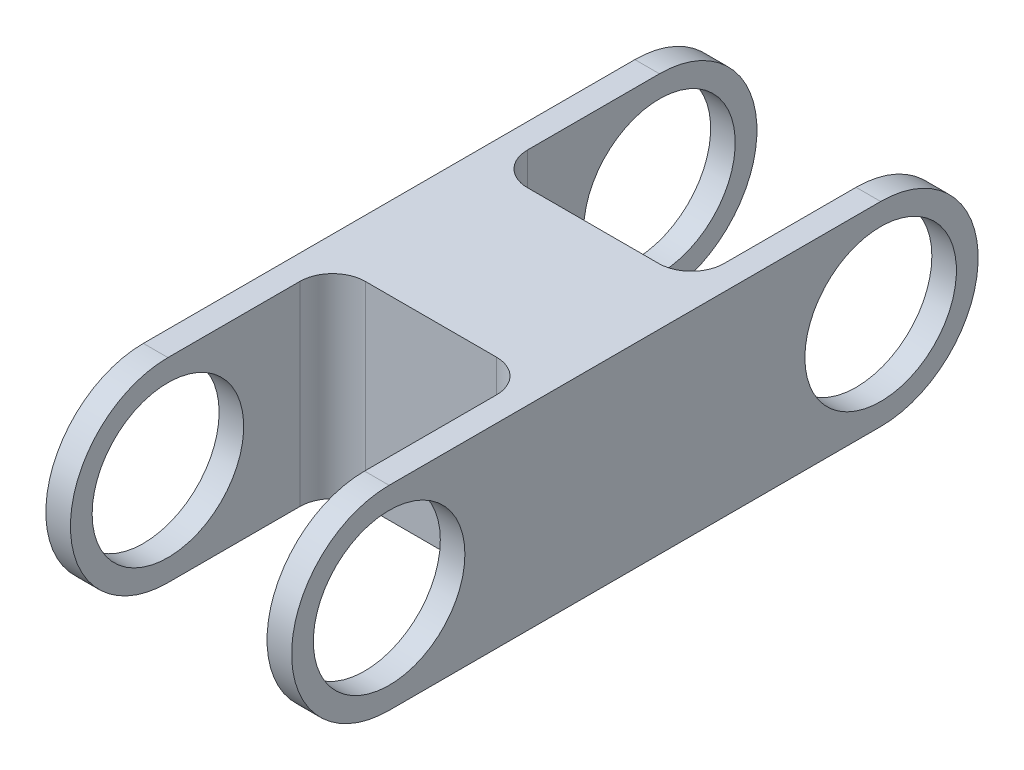
from build123d import *

# Parameters (mm, degrees)
SKETCH1_R           = 9.25
BOSS_EXTRUDE1_DEPTH = 30
SKETCH2_W           = 24
SKETCH2_H           = 32
CUT_EXTRUDE1_DEPTH  = 82.46195431
FILLET1_R           = 4


with BuildPart() as part:
    # Sketch1 → Boss-Extrude1 (new body)
    with BuildSketch(Plane(origin=(0, 0, 0), x_dir=(0, 0, -1), z_dir=(1, 0, 0))):
        with BuildLine():
            Line((0, 11.9), (60, 11.9))
            ThreePointArc((60, 11.9), (71.9, 0), (60, -11.9))
            Line((60, -11.9), (0, -11.9))
            ThreePointArc((0, -11.9), (-11.9, 0), (0, 11.9))
        make_face()
        Circle(SKETCH1_R, mode=Mode.SUBTRACT)
        with Locations((60, 0)):
            Circle(SKETCH1_R, mode=Mode.SUBTRACT)
    extrude(amount=BOSS_EXTRUDE1_DEPTH)

    # Sketch2 → Cut-Extrude1 (cut, through all)
    with BuildSketch(Plane(origin=(0, 11.9, 0), x_dir=(1, 0, 0), z_dir=(0, 1, 0))):
        with Locations((15, 4.1)):
            Rectangle(SKETCH2_W, SKETCH2_H)
        with Locations((15, 55.9)):
            Rectangle(SKETCH2_W, SKETCH2_H)
    extrude(amount=-CUT_EXTRUDE1_DEPTH, mode=Mode.SUBTRACT)

    # Fillet1
    fillet1_edges = [part.edges().sort_by_distance(p)[0] for p in [
        (27, 0, -20.1),
        (3, 0, -20.1),
        (27, 0, -39.9),
        (3, 0, -39.9),
    ]]
    fillet(fillet1_edges, radius=FILLET1_R)


solid = part.part
